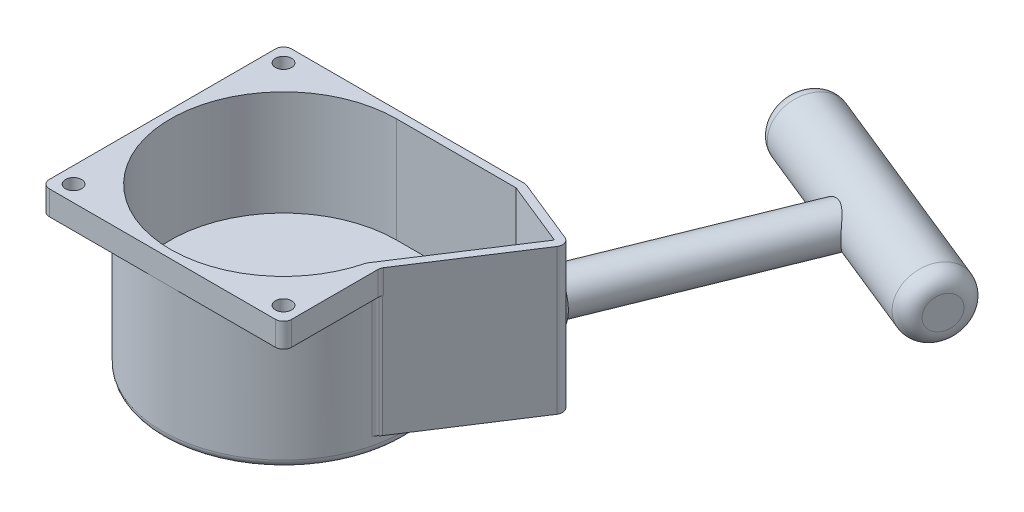
from build123d import *

# Parameters (mm, degrees)
SKETCH1_R                = 15
BOSS_EXTRUDE1_DEPTH      = 17
SKETCH2_W                = 30
SKETCH2_H                = 30
BOSS_EXTRUDE2_DEPTH      = 3
FILLET2_R                = 1
BOSS_EXTRUDE4_DEPTH      = 3
BOSS_EXTRUDE5_DEPTH      = 18
FILLET5_R                = 1
FILLET6_R                = 1
FILLET7_R                = 1
SKETCH7_R                = 14
CUT_EXTRUDE1_DEPTH       = 13
SKETCH8_R                = 1.5
CUT_EXTRUDE2_DEPTH       = 13
SKETCH9_R                = 3.5
BOSS_EXTRUDE6_DEPTH      = 1
CUT_EXTRUDE3_START       = -1
SKETCH10_R               = 1.5
CUT_EXTRUDE3_DEPTH       = 1
FILLET8_R                = 1
SKETCH13_R               = 1
CUT_EXTRUDE4_DEPTH       = 35.607752779
SKETCH14_R               = 2.5
BOSS_EXTRUDE7_DEPTH      = 30
BOSS_EXTRUDE8_DEPTH      = 16
BOSS_EXTRUDE8_DEPTH_BACK = 16
SKETCH17_R               = 4
FILLET9_R                = 2


# Some blends are built 0.0001 mm under size
with BuildPart() as part:
    # Sketch1 → Boss-Extrude1 (new body)
    with BuildSketch(Plane(origin=(0, 0, 0), x_dir=(1, 0, 0), z_dir=(0, 1, 0))):
        with Locations(Location((0, 0, 0), (0, 0, 270))):
            Circle(SKETCH1_R)
    extrude(amount=BOSS_EXTRUDE1_DEPTH)

    # Sketch2 → Boss-Extrude2 (add)
    with BuildSketch(Plane(origin=(0, 17, 0), x_dir=(1, 0, 0), z_dir=(0, 1, 0))):
        Rectangle(SKETCH2_W, SKETCH2_H)
    extrude(amount=BOSS_EXTRUDE2_DEPTH)

    # Fillet2
    fillet2_edges = [part.edges().sort_by_distance(p)[0] for p in [
        (0, 0, -15),
    ]]
    fillet(fillet2_edges, radius=FILLET2_R)

    # Sketch4 → Boss-Extrude4 (add)
    with BuildSketch(Plane(origin=(0, 20, 0), x_dir=(1, 0, 0), z_dir=(0, 1, 0))):
        Polygon((15, 15), (24.270248109, 11.25), (15, -3), align=None)
    extrude(amount=-BOSS_EXTRUDE4_DEPTH)

    # Sketch6 → Boss-Extrude5 (add)
    with BuildSketch(Plane(origin=(0, 20, 0), x_dir=(1, 0, 0), z_dir=(0, 1, 0))):
        Polygon((15, -3), (0, -3), (0, 15), (15, 15), (24.270248109, 11.25), align=None)
    extrude(amount=-BOSS_EXTRUDE5_DEPTH)

    # Fillet5
    fillet5_edges = [part.edges().sort_by_distance(p)[0] for p in [
        (15, 18.5, 3),
        (24.270248109, 11, -11.25),
        (15, 18.5, 15),
        (15, 11, -15),
        (-15, 18.5, -15),
        (-15, 18.5, 15),
    ]]
    fillet(fillet5_edges, radius=FILLET5_R)

    # Fillet6
    # the kernel refuses this fillet: 1 mm, written as the material it adds along each edge
    with BuildSketch(Plane(origin=(14.696938457, 18.556304537, 3), x_dir=(-0.2202884134263797, 0, 0.9754347824996238), z_dir=(0, -1, 0))) as fillet6_piece_1:
        with BuildLine():
            CenterArc((0.643272542, -0.99978468), FILLET6_R, 91.189014428, 44.048625674)
            Line((-0.066760947, -0.295616771), (-0.080961616, -0.281533412))
            ThreePointArc((-0.080961616, -0.281533412), (-0.052889169, -0.143402617), (-0.019508696, 0.004405768))
            Line((-0.019508696, 0.004405768), (0.000415015, 0.019995694))
            ThreePointArc((0.000415015, 0.019995694), (0.311260907, 0.016770207), (0.6221068, 0.019995694))
            Line((0.6221068, 0.019995694), (0.622521815, 0))
        make_face()
    extrude(amount=16.556304537)

    # Fillet7
    fillet7_edges = [part.edges().sort_by_distance(p)[0] for p in [
        (15, 9.5, 3),
    ]]
    fillet(fillet7_edges, radius=FILLET7_R)

    # Sketch7 → Cut-Extrude1 (cut)
    with BuildSketch(Plane(origin=(0, 20, 0), x_dir=(1, 0, 0), z_dir=(0, 1, 0))):
        with BuildLine():
            Line((14.805399496, 14), (0, 14))
            ThreePointArc((0, 14), (9.899494937, 9.899494937), (14, 0))
            ThreePointArc((14, 0), (13.900075645, -1.66969969), (13.601728992, -3.31556457))
            Line((13.601728992, -3.31556457), (22.770248109, 10.778060096))
            Line((22.770248109, 10.778060096), (14.805399496, 14))
        make_face()
        Circle(SKETCH7_R)
    extrude(amount=-CUT_EXTRUDE1_DEPTH, mode=Mode.SUBTRACT)

    # Sketch8 → Cut-Extrude2 (cut)
    with BuildSketch(Plane(origin=(7.323889561, 0, -18.105139561), x_dir=(-0.927024810886958, 0, -0.3749999999999998), z_dir=(0.3749999999999998, 0, -0.927024810886958))):
        with Locations((-12.770892539, 11)):
            Circle(SKETCH8_R)
    extrude(amount=-CUT_EXTRUDE2_DEPTH, mode=Mode.SUBTRACT)

    # Sketch9 → Boss-Extrude6 (add)
    with BuildSketch(Plane(origin=(7.323889561, 0, -18.105139561), x_dir=(-0.927024810886958, 0, -0.3749999999999998), z_dir=(0.3749999999999998, 0, -0.927024810886958))):
        with Locations((-12.770892539, 11)):
            Circle(SKETCH9_R)
    extrude(amount=BOSS_EXTRUDE6_DEPTH)

    # Sketch10 → Cut-Extrude3 (cut)
    with BuildSketch(Plane(origin=(7.323889561, 0, -18.105139561), x_dir=(0.927024810886958, 0, 0.3749999999999998), z_dir=(-0.3749999999999998, 0, 0.927024810886958)).offset(CUT_EXTRUDE3_START)):
        with Locations((12.770892539, 11)):
            Circle(SKETCH10_R)
    extrude(amount=CUT_EXTRUDE3_DEPTH, mode=Mode.SUBTRACT)

    # Fillet8
    fillet8_edges = [part.edges().sort_by_distance(p)[0] for p in [
        (22.78241064, 11, -12.93057967),
    ]]
    fillet(fillet8_edges, radius=FILLET8_R - 0.0001)  # a hair under: the kernel refuses the full size

    # Sketch13 → Cut-Extrude4 (cut, through all)
    with BuildSketch(Plane(origin=(0, 20, 0), x_dir=(1, 0, 0), z_dir=(0, 1, 0))):
        with Locations(Location((-13, 13, 0), (0, 0, 270))):
            Circle(SKETCH13_R)
        with Locations(Location((-13, -13, 0), (0, 0, 270))):
            Circle(SKETCH13_R)
        with Locations(Location((13, -13, 0), (0, 0, 270))):
            Circle(SKETCH13_R)
    extrude(amount=-CUT_EXTRUDE4_DEPTH, mode=Mode.SUBTRACT)

    # Sketch14 → Boss-Extrude7 (add)
    with BuildSketch(Plane(origin=(7.698889561, 0, -19.032164372), x_dir=(-0.927024810886958, 0, -0.3749999999999998), z_dir=(0.3749999999999998, 0, -0.927024810886958))):
        with Locations((-12.770892539, 11)):
            Circle(SKETCH14_R)
    extrude(amount=BOSS_EXTRUDE7_DEPTH)

    # Sketch17 → Boss-Extrude8 (add, two sides: drawn at the far end of the back side and taken through both)
    with BuildSketch(Plane(origin=(11.838934241, 0, 4.789084702), x_dir=(0.3749999999999998, 0, -0.927024810886958), z_dir=(0.927024810886958, 0, 0.3749999999999998)).offset(-BOSS_EXTRUDE8_DEPTH_BACK)):
        with Locations((50.530372163, 11)):
            Circle(SKETCH17_R)
    extrude(amount=BOSS_EXTRUDE8_DEPTH + BOSS_EXTRUDE8_DEPTH_BACK)

    # Fillet9
    fillet9_edges = [part.edges().sort_by_distance(p)[0] for p in [
        (14.455426828, 11, -44.345724753),
        (44.120220776, 11, -32.345724753),
    ]]
    fillet(fillet9_edges, radius=FILLET9_R)


solid = part.part
